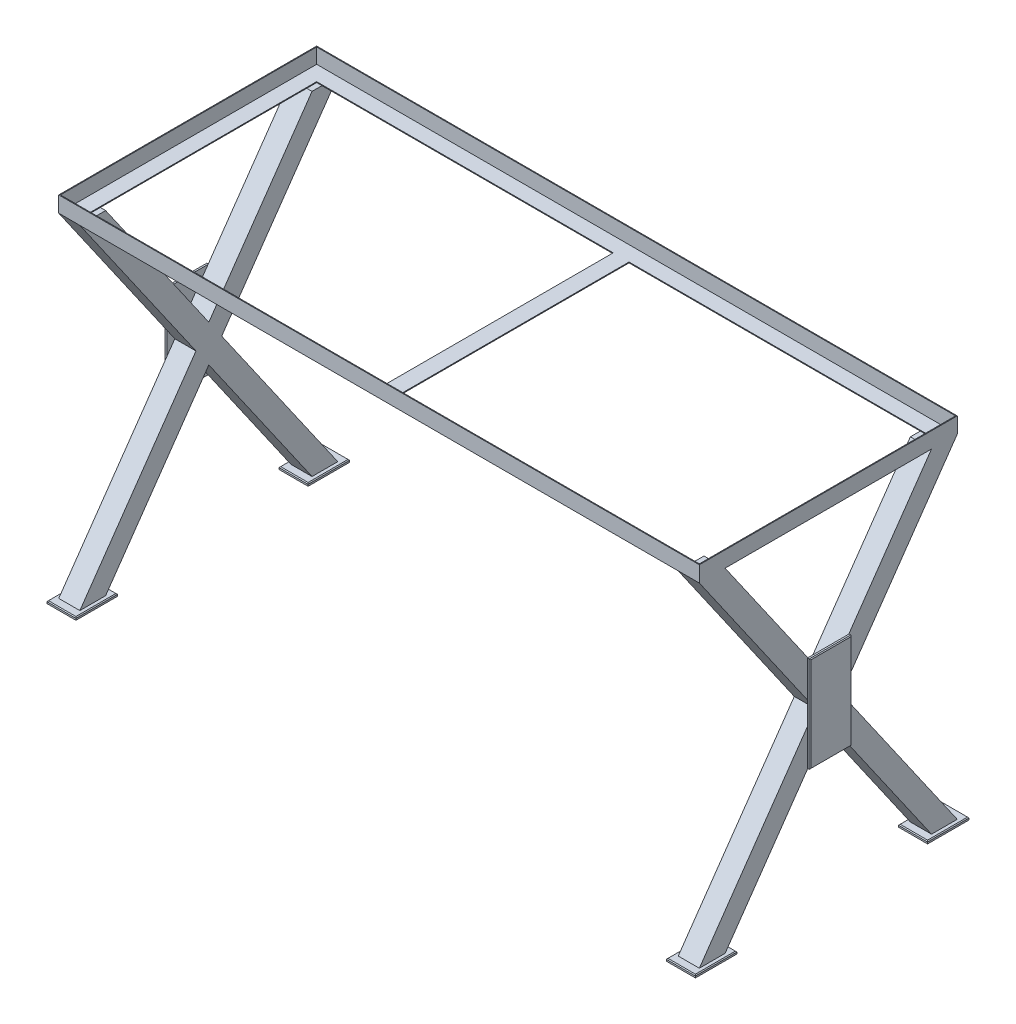
from build123d import *

# Parameters (mm, degrees)
CROQUIS1_W                 = 1540
CROQUIS1_H                 = 620
SALIENTE_EXTRUIR1_DEPTH    = 38.1
VACIADO1_T                 = -2
CROQUIS2_W                 = 1463.8
CROQUIS2_H                 = 543.8
CORTAR_EXTRUIR1_DEPTH      = 38.1
SALIENTE_EXTRUIR2_DEPTH    = 50.8
CROQUIS4_W                 = 100
CROQUIS4_H                 = 230
SALIENTE_EXTRUIR3_DEPTH    = 6
CHAFL_N1_SIZE              = 2
CROQUIS5_W                 = 70
CROQUIS5_H                 = 100
SALIENTE_EXTRUIR4_DEPTH    = 6
CHAFL_N2_SIZE              = 2
CHAFL_N2_OF_SIMETR_A2_SIZE = 2
CROQUIS6_W                 = 38.1
CROQUIS6_H                 = 543.8
SALIENTE_EXTRUIR5_DEPTH    = 2


# Read off the part's stored shape, not the designer's step: Simetría3
with BuildPart() as part:
    # Croquis1 → Saliente-Extruir1 (new body)
    with BuildSketch(Plane(origin=(0, 0, 0), x_dir=(1, 0, 0), z_dir=(0, 1, 0))):
        Rectangle(CROQUIS1_W, CROQUIS1_H)
    extrude(amount=SALIENTE_EXTRUIR1_DEPTH)

    # Vaciado1
    vaciado1_openings = [part.faces().sort_by_distance(p)[0] for p in [
        (0, 38.1, 0),
    ]]
    offset(amount=VACIADO1_T, openings=vaciado1_openings, kind=Kind.INTERSECTION)

    # Croquis2 → Cortar-Extruir1 (cut)
    with BuildSketch(Plane(origin=(0, 2, 0), x_dir=(1, 0, 0), z_dir=(0, 1, 0))):
        Rectangle(CROQUIS2_W, CROQUIS2_H)
    extrude(amount=-CORTAR_EXTRUIR1_DEPTH, mode=Mode.SUBTRACT)

    # Croquis3 → Saliente-Extruir2 (add)
    with BuildSketch(Plane(origin=(770, 0, 0), x_dir=(0, 0, -1), z_dir=(1, 0, 0))):
        Polygon((-310, 0), (-30.946230524, -400.95), (-310, -801.9), (-248.107538953, -801.9), (0, -445.414158831), (248.107538953, -801.9), (310, -801.9), (30.946230524, -400.95), (310, 0), (248.107538953, 0), (0, -356.485841169), (-248.107538953, 0), align=None)
    extrude(amount=-SALIENTE_EXTRUIR2_DEPTH)

    # Croquis4 → Saliente-Extruir3 (add)
    with BuildSketch(Plane(origin=(770, 0, 0), x_dir=(0, 0, -1), z_dir=(1, 0, 0))):
        with Locations((0, -400.95)):
            Rectangle(CROQUIS4_W, CROQUIS4_H)
    extrude(amount=SALIENTE_EXTRUIR3_DEPTH)

    # Chaflán1
    chafl_n1_edges = [part.edges().sort_by_distance(p)[0] for p in [
        (776, -400.95, -50),
        (776, -285.95, 0),
        (776, -400.95, 50),
        (776, -515.95, 0),
    ]]
    chamfer(chafl_n1_edges, length=CHAFL_N1_SIZE)

    # Croquis5 → Saliente-Extruir4 (add)
    with BuildSketch(Plane.XZ.offset(801.9)):
        with Locations((744.6, 279.053769476)):
            Rectangle(CROQUIS5_W, CROQUIS5_H)
    saliente_extruir4 = extrude(amount=SALIENTE_EXTRUIR4_DEPTH)

    # Chaflán2
    chafl_n2_edges = [part.edges().sort_by_distance(p)[0] for p in [
        (779.6, -801.9, 279.053769476),
        (744.6, -801.9, 329.053769476),
        (709.6, -801.9, 279.053769476),
        (744.6, -801.9, 229.053769476),
    ]]
    chamfer(chafl_n2_edges, length=CHAFL_N2_SIZE)

    # Simetría2: Saliente-Extruir4 across plane
    add(saliente_extruir4.mirror(Plane.XY))

    # Chaflán2 of Simetría2
    chafl_n2_of_simetr_a2_edges = [part.edges().sort_by_distance(p)[0] for p in [
        (779.6, -801.9, -279.053769476),
        (744.6, -801.9, -329.053769476),
        (709.6, -801.9, -279.053769476),
        (744.6, -801.9, -229.053769476),
    ]]
    chamfer(chafl_n2_of_simetr_a2_edges, length=CHAFL_N2_OF_SIMETR_A2_SIZE)

    # Croquis6 → Saliente-Extruir5 (add)
    with BuildSketch(Plane.XZ):
        Rectangle(CROQUIS6_W, CROQUIS6_H)
    extrude(amount=-SALIENTE_EXTRUIR5_DEPTH)

    # Simetría3: part across plane


with BuildPart() as part_1:
    add(part.part)
    add(part.part.mirror(Plane(origin=(0, 0, 0), x_dir=(0, 0, 1), z_dir=(1, 0, 0))))


solid = part_1.part
